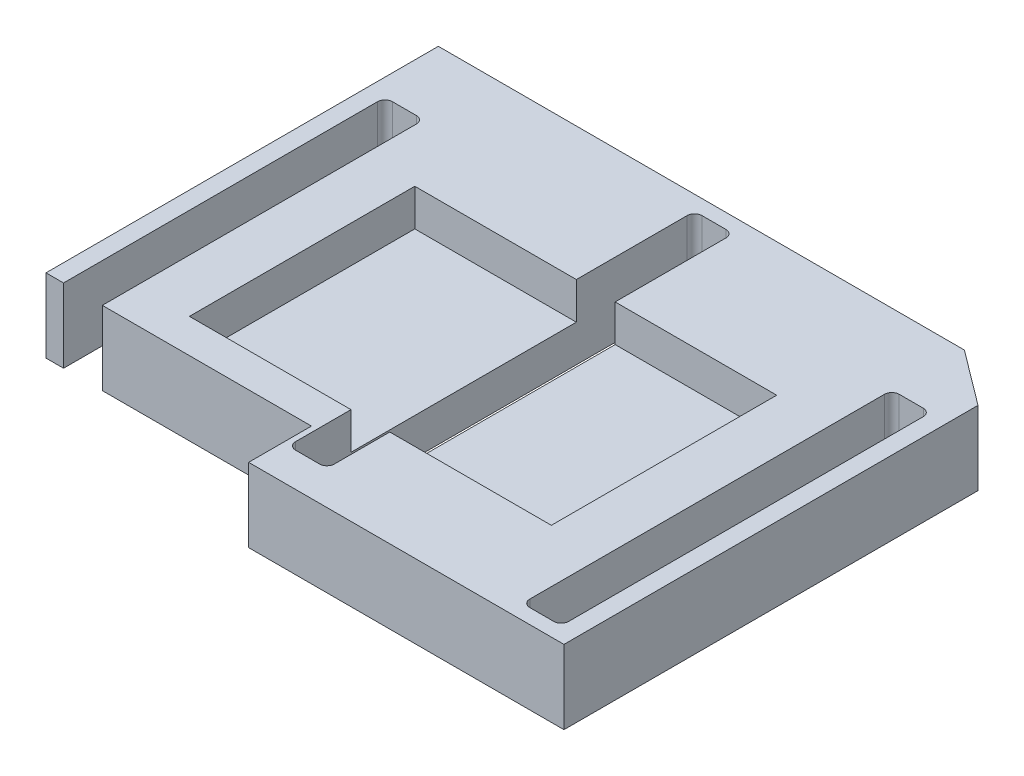
from build123d import *

# Parameters (mm, degrees)
BOSS_EXTRUDE1_DEPTH = 10
FILLET1_R           = 1
SKETCH2_W           = 21.86553483
SKETCH2_H           = 30.5
CUT_EXTRUDE1_DEPTH  = 5
MIRROR1_DEPTH       = 10
MIRROR1_2_OUTLINE_W = 21.86553483
MIRROR1_2_OUTLINE_H = 30.5
MIRROR1_2_DEPTH     = 5
SKETCH6_W           = 35.925
SKETCH6_H           = 8.5
CUT_EXTRUDE2_DEPTH  = 10


# Read off the part's stored shape, not the designer's step: Mirror1
with BuildPart() as part:
    # Sketch1 → Boss-Extrude1 (new body)
    with BuildSketch(Plane(origin=(0, 0, 0), x_dir=(1, 0, 0), z_dir=(0, 1, 0))):
        Polygon((-5, 57.097150921), (34.3, 57.097150921), (34.3, 55.097150921), (31.675, 55.097150921), (31.675, 52.597150921), (31.675, 2.599340873), (31.675, 0.099340873), (34.3, 0.099340873), (34.3, -4.5), (-5, -4.5), align=None)
        Polygon((-2.625, 45), (-2.625, 0), (-2.625, -2.5), (0, -2.5), (2.625, -2.5), (2.625, 0), (2.625, 45), (2.625, 47.5), (0, 47.5), (-2.625, 47.5), align=None, mode=Mode.SUBTRACT)
    extrude(amount=BOSS_EXTRUDE1_DEPTH)

    # Fillet1
    fillet1_edges = [part.edges().sort_by_distance(p)[0] for p in [
        (31.675, 5, -55.097150921),
        (31.675, 5, -0.099340873),
        (-2.625, 5, -47.5),
        (-2.625, 5, 2.5),
        (2.625, 5, 2.5),
        (2.625, 5, -47.5),
    ]]
    fillet(fillet1_edges, radius=FILLET1_R)

    # Sketch2 → Cut-Extrude1 (cut)
    with BuildSketch(Plane(origin=(0, 10, 0), x_dir=(1, 0, 0), z_dir=(0, 1, 0))):
        with Locations((20.742232585, 23.8519351)):
            Rectangle(SKETCH2_W, SKETCH2_H)
    extrude(amount=-CUT_EXTRUDE1_DEPTH, mode=Mode.SUBTRACT)

    # Mirror1 outline → Mirror1 (add)
    with BuildSketch(Plane(origin=(0, 0, 0), x_dir=(1, 0, 0), z_dir=(0, 1, 0))):
        with BuildLine():
            ThreePointArc((35.925, 55.097150921), (36.632106781, 54.804257702), (36.925, 54.097150921))
            Line((36.925, 54.097150921), (36.925, 39.1019351))
            Line((36.925, 39.1019351), (58.79053483, 39.1019351))
            Line((58.79053483, 39.1019351), (58.79053483, 8.6019351))
            Line((58.79053483, 8.6019351), (36.925, 8.6019351))
            Line((36.925, 8.6019351), (36.925, 1.099340873))
            ThreePointArc((36.925, 1.099340873), (36.632106781, 0.392234092), (35.925, 0.099340873))
            Line((35.925, 0.099340873), (34.3, 0.099340873))
            Line((34.3, 0.099340873), (34.3, -4.5))
            Line((34.3, -4.5), (73.6, -4.5))
            Line((73.6, -4.5), (73.6, 57.097150921))
            Line((73.6, 57.097150921), (34.3, 57.097150921))
            Line((34.3, 57.097150921), (34.3, 55.097150921))
            Line((34.3, 55.097150921), (35.925, 55.097150921))
        make_face()
        with BuildLine():
            Line((70.225, -2.5), (66.975, -2.5))
            ThreePointArc((66.975, -2.5), (66.267893219, -2.207106781), (65.975, -1.5))
            Line((65.975, -1.5), (65.975, 46.5))
            ThreePointArc((65.975, 46.5), (66.267893219, 47.207106781), (66.975, 47.5))
            Line((66.975, 47.5), (70.225, 47.5))
            ThreePointArc((70.225, 47.5), (70.932106781, 47.207106781), (71.225, 46.5))
            Line((71.225, 46.5), (71.225, -1.5))
            ThreePointArc((71.225, -1.5), (70.932106781, -2.207106781), (70.225, -2.5))
        make_face(mode=Mode.SUBTRACT)
    extrude(amount=MIRROR1_DEPTH)

    # Mirror1 2 outline → Mirror1 2 (add)
    with BuildSketch(Plane(origin=(0, 0, 0), x_dir=(1, 0, 0), z_dir=(0, 1, 0))):
        with Locations((47.857767415, 23.8519351)):
            Rectangle(MIRROR1_2_OUTLINE_W, MIRROR1_2_OUTLINE_H)
    extrude(amount=MIRROR1_2_DEPTH)

    # Sketch6 → Cut-Extrude2 (cut)
    with BuildSketch(Plane(origin=(0, 10, 0), x_dir=(1, 0, 0), z_dir=(0, 1, 0))):
        with Locations((12.9625, -0.25)):
            Rectangle(SKETCH6_W, SKETCH6_H)
        Polygon((73.6, 57.097150921), (66.19379908, 57.097150921), (73.6, 51.534362721), align=None)
    extrude(amount=-CUT_EXTRUDE2_DEPTH, mode=Mode.SUBTRACT)


solid = part.part
